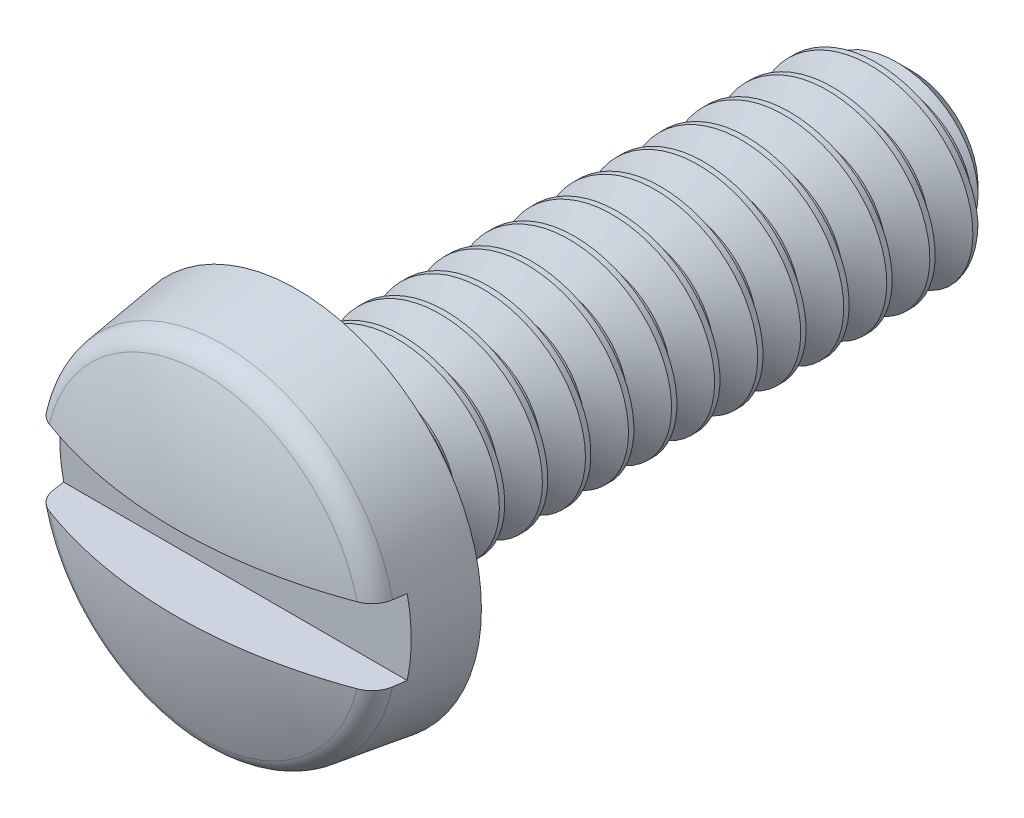
from build123d import *

# Parameters (mm, degrees)
SKETCH4_W          = 3
SKETCH4_H          = 0.6125
CUT_EXTRUDE1_DEPTH = 0.5
CHAMFER1_SIZE      = 0.2625
CUT_SWEEP1_PITCH   = 0.35


# Read off the part's stored shape, not the designer's step: Split1
with BuildPart() as part:
    # Sketch2 → Revolve1 (revolve)
    with BuildSketch(Plane(origin=(0, 0, 0), x_dir=(0, 0, -1), z_dir=(1, 0, 0)), mode=Mode.PRIVATE) as revolve1_sk:
        Polygon((-3, 0), (-3, 1.5), (-2, 1.5), (-2, 0.8), (3, 0.8), (3, 0), align=None)
    revolve(revolve1_sk.sketch.rotate(Axis((0, 0, -3), (0, 0, 1)), 90), axis=Axis((0, 0, -3), (0, 0, 1)))

    # Sketch3 → Cut-Revolve1 (revolve, cut)
    with BuildSketch(Plane(origin=(0, 0, 0), x_dir=(0, 0, -1), z_dir=(1, 0, 0)), mode=Mode.PRIVATE) as cut_revolve1_sk:
        with BuildLine():
            Line((-3.254, 0), (-3.254, 1.56))
            Line((-3.254, 1.56), (-2, 1.56))
            Line((-2, 1.56), (-2, 1.5))
            Line((-2, 1.5), (-2.603211591, 1.415224139))
            ThreePointArc((-2.603211591, 1.415224139), (-2.7, 1.373596549), (-2.762202863, 1.288557403))
            ThreePointArc((-2.762202863, 1.288557403), (-2.94005299, 0.655157931), (-3, 0))
            Line((-3, 0), (-3.254, 0))
        make_face()
    revolve(cut_revolve1_sk.sketch.rotate(Axis((0, 0, 3), (0, 0, -1)), 90), axis=Axis((0, 0, 3), (0, 0, -1)), mode=Mode.SUBTRACT)


with BuildPart() as body_2:
    # Split1: the piece on the far side of the plane
    add(part.part)
    split(bisect_by=Plane.XY.offset(2), keep=Keep.BOTTOM)

    # Chamfer1
    chamfer1_edges = [body_2.edges().sort_by_distance(p)[0] for p in [
        (0.8, 0, -3),
    ]]
    chamfer(chamfer1_edges, length=CHAMFER1_SIZE)

    # Cut-Sweep1: the profile of Sketch6 profile screwed along a right-hand helix of 15.285714 turns, 6 arcs to a turn; built about Z, then put on its axis
    cut_sweep1_z = Axis((0, 0, 0), (0, 0, 1))
    cut_sweep1_corners = [(0.8003, 0, 0.000173205), (0.8003, 0, -0.306423205), (0.572668332, 0, -0.175), (0.572668332, 0, -0.13125)]
    with BuildLine(mode=Mode.PRIVATE) as cut_sweep1_profile:
        Line(cut_sweep1_corners[0], cut_sweep1_corners[1])
        Line(cut_sweep1_corners[1], cut_sweep1_corners[2])
        Line(cut_sweep1_corners[2], cut_sweep1_corners[3])
        Line(cut_sweep1_corners[3], cut_sweep1_corners[0])
    cut_sweep1_cap = Face(cut_sweep1_profile.wire())
    cut_sweep1_turn_angles = [0, 30, 60, 90, 120, 150, 180, 210, 240, 270, 300, 330, 360]
    cut_sweep1_turn_weights = [1, 0.8660254037844387, 1, 0.8660254037844387, 1, 0.8660254037844387, 1, 0.8660254037844387, 1, 0.8660254037844387, 1, 0.8660254037844387, 1]
    cut_sweep1_turn_rails = [Edge.make_bspline([Vector(p[0], p[1], 0).rotate(cut_sweep1_z, cut_sweep1_turn_angles[k]) / cut_sweep1_turn_weights[k] + Vector(0, 0, p[2] + CUT_SWEEP1_PITCH * cut_sweep1_turn_angles[k] / 360) for k in range(13)], [0, 0, 0, 1, 1, 2, 2, 3, 3, 4, 4, 5, 5, 6, 6, 6], 2, cut_sweep1_turn_weights) for p in cut_sweep1_corners]
    cut_sweep1_turn_sides = [Face.make_surface_from_curves(cut_sweep1_turn_rails[p[0]], cut_sweep1_turn_rails[p[1]]) for p in [(0, 1), (1, 2), (2, 3), (3, 0)]]
    cut_sweep1_last_angles = [5400, 5430, 5460, 5481.428571429, 5502.857142857]
    cut_sweep1_last_weights = [1, 0.8660254037844387, 1, 0.9308737486442208, 1]
    cut_sweep1_last_rails = [Edge.make_bspline([Vector(p[0], p[1], 0).rotate(cut_sweep1_z, cut_sweep1_last_angles[k]) / cut_sweep1_last_weights[k] + Vector(0, 0, p[2] + CUT_SWEEP1_PITCH * cut_sweep1_last_angles[k] / 360) for k in range(5)], [0, 0, 0, 1, 1, 2, 2, 2], 2, cut_sweep1_last_weights) for p in cut_sweep1_corners]
    cut_sweep1_last_sides = [Face.make_surface_from_curves(cut_sweep1_last_rails[p[0]], cut_sweep1_last_rails[p[1]]) for p in [(0, 1), (1, 2), (2, 3), (3, 0)]]
    cut_sweep1 = Plane(origin=(0, 0, -3), x_dir=(0, 1, 0), z_dir=(0, 0, 1)) * Solid(Shell([*[p.moved(Location((0, 0, CUT_SWEEP1_PITCH * i))) for i in range(15) for p in cut_sweep1_turn_sides], *cut_sweep1_last_sides, cut_sweep1_cap, cut_sweep1_cap.rotate(cut_sweep1_z, 5502.857142857).moved(Location((0, 0, CUT_SWEEP1_PITCH * 5502.857142857 / 360)))]))
    add(cut_sweep1, mode=Mode.SUBTRACT)


with BuildPart() as part_1:
    add(part.part)

    # Split1
    split(bisect_by=Plane.XY.offset(2), keep=Keep.TOP)

    # Sketch4 → Cut-Extrude1 (cut)
    with BuildSketch(Plane.XY.offset(3)):
        Rectangle(SKETCH4_W, SKETCH4_H)
    extrude(amount=-CUT_EXTRUDE1_DEPTH, mode=Mode.SUBTRACT)

    # Combine1: union body 2
    add(body_2.part)


solid = part_1.part
